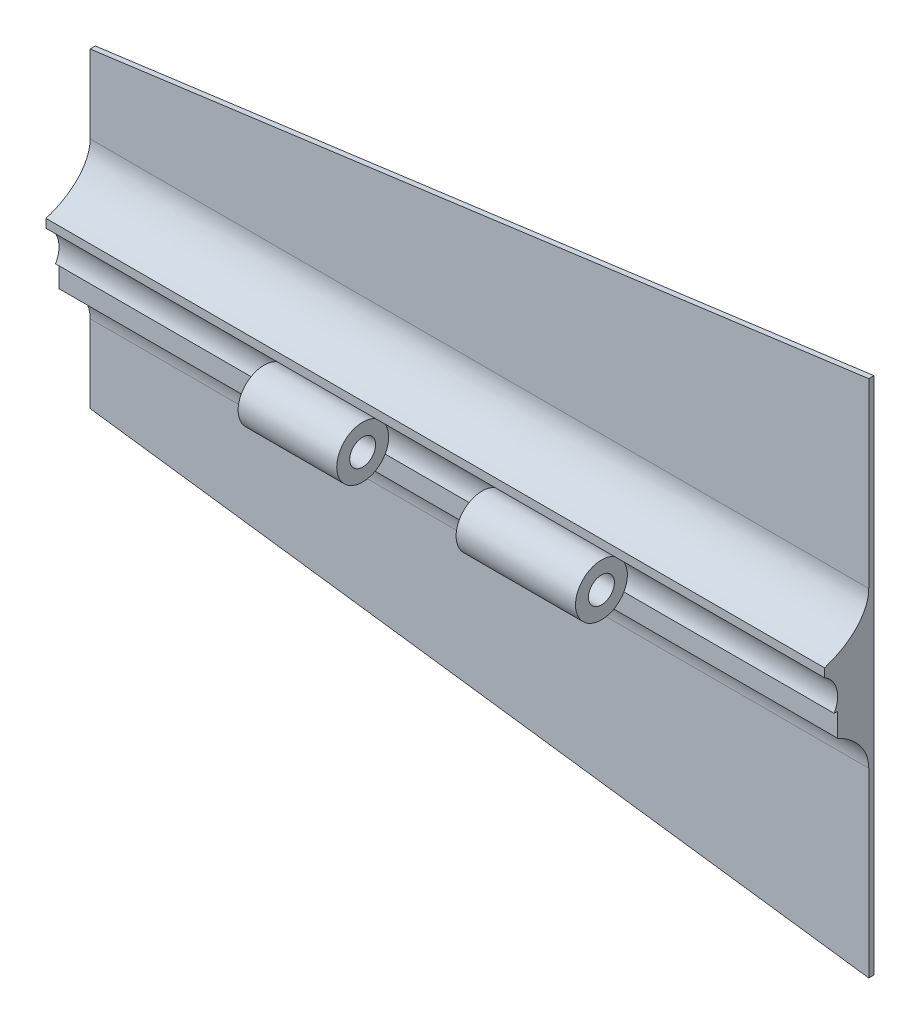
from build123d import *

# Parameters (mm, degrees)
BOSS_EXTRUDE1_DEPTH      = 1
BOSS_EXTRUDE5_DEPTH      = 100
BOSS_EXTRUDE5_DEPTH_BACK = 1
SKETCH2_W                = 214
SKETCH2_H                = 10
FILLET3_SIZE             = 15
FILLET3_SIZE_2           = 10
CUT_EXTRUDE2_DEPTH       = 229
SKETCH7_W                = 64
SKETCH7_H                = 10
CUT_EXTRUDE3_DEPTH       = 14
EXTRUDE_THIN2_START      = -40.5
SKETCH9_R                = 5
SKETCH9_R_2              = 2.5
EXTRUDE_THIN2_DEPTH      = 23
EXTRUDE_THIN3_START      = -86.5
SKETCH9_3_R              = 5
SKETCH9_3_R_2            = 2.5
EXTRUDE_THIN3_DEPTH      = 19
CUT_EXTRUDE8_DEPTH       = 71
CUT_EXTRUDE8_DEPTH_BACK  = 153


with BuildPart() as part:
    # Sketch1 → Boss-Extrude1 (new body)
    with BuildSketch(Plane.XY):
        Polygon((75, 50), (75, -50), (-75, -30), (-75, 30), align=None)
    extrude(amount=BOSS_EXTRUDE1_DEPTH)

    # Sketch2 → Boss-Extrude5 (add, two sides: drawn at the far end of the back side and taken through both)
    with BuildSketch(Plane.XY.offset(1).offset(-BOSS_EXTRUDE5_DEPTH_BACK)):
        with Locations((32, 0)):
            Rectangle(SKETCH2_W, SKETCH2_H)
    extrude(amount=BOSS_EXTRUDE5_DEPTH + BOSS_EXTRUDE5_DEPTH_BACK)

    # Fillet3
    # an asymmetric fillet: 15, 10 mm, written as the material it adds along each edge
    with BuildSketch(Plane(origin=(75, -5, 1), x_dir=(0, 0, 1), z_dir=(-1, 0, 0))) as fillet3_piece_1:
        with BuildLine():
            Bezier((FILLET3_SIZE, 0), (0, 0), (0, -FILLET3_SIZE_2), weights=[1, 0.707106781, 1])
            Line((0, -FILLET3_SIZE_2), (0, 0))
            Line((0, 0), (FILLET3_SIZE, 0))
        make_face()
    extrude(amount=150)
    with BuildSketch(Plane(origin=(-75, 5, 1), x_dir=(0, 1, 0), z_dir=(1, 0, 0))) as fillet3_piece_2:
        with BuildLine():
            Bezier((FILLET3_SIZE_2, 0), (0, 0), (0, FILLET3_SIZE), weights=[1, 0.707106781, 1])
            Line((0, FILLET3_SIZE), (0, 0))
            Line((0, 0), (FILLET3_SIZE_2, 0))
        make_face()
    extrude(amount=150)

    # Sketch6 → Cut-Extrude2 (cut)
    with BuildSketch(Plane.ZY.offset(75)):
        with BuildLine():
            Line((9.5, 6.986773712), (9.5, 4.330127019))
            ThreePointArc((9.5, 4.330127019), (7, 0), (9.5, -4.330127019))
            Line((9.5, -4.330127019), (9.5, -7.297871365))
            Line((9.5, -7.297871365), (14.5, -7.297871365))
            Line((14.5, -7.297871365), (14.5, -4.330127019))
            ThreePointArc((14.5, -4.330127019), (17, 0), (14.5, 4.330127019))
            Line((14.5, 4.330127019), (14.5, 6.986773712))
            Line((14.5, 6.986773712), (9.5, 6.986773712))
        make_face()
    extrude(amount=-CUT_EXTRUDE2_DEPTH, mode=Mode.SUBTRACT)


with BuildPart() as cut_extrude2_piece_1:
    # of the separate pieces the step leaves, piece 1, a body of its own (cut_extrude2_pieces)
    add(part.part.solids().sort_by_distance((-75, 5.050125629, 14.5))[0])


with BuildPart() as cut_extrude2_piece_2:
    # of the separate pieces the step leaves, piece 2, a body of its own (cut_extrude2_pieces)
    add(part.part.solids().sort_by_distance((-75, 15, 1))[0])

    # Sketch7 → Cut-Extrude3 (cut)
    with BuildSketch(Plane(origin=(0, 0, 0), x_dir=(-1, 0, 0), z_dir=(0, 0, -1))):
        with Locations((-107, 0)):
            Rectangle(SKETCH7_W, SKETCH7_H)
    extrude(amount=-CUT_EXTRUDE3_DEPTH, mode=Mode.SUBTRACT)

    # Sketch9 → Extrude-Thin2 (add)
    with BuildSketch(Plane(origin=(75, 0, 0), x_dir=(0, 0, -1), z_dir=(1, 0, 0)).offset(EXTRUDE_THIN2_START)):
        with Locations((-12, 0)):
            Circle(SKETCH9_R)
        with Locations((-12, 0)):
            Circle(SKETCH9_R_2, mode=Mode.SUBTRACT)
    extrude(amount=-EXTRUDE_THIN2_DEPTH)

    # Sketch9<3> → Extrude-Thin3 (add)
    with BuildSketch(Plane(origin=(75, 0, 0), x_dir=(0, 0, -1), z_dir=(1, 0, 0)).offset(EXTRUDE_THIN3_START)):
        with Locations((-12, 0)):
            Circle(SKETCH9_3_R)
        with Locations((-12, 0)):
            Circle(SKETCH9_3_R_2, mode=Mode.SUBTRACT)
    extrude(amount=-EXTRUDE_THIN3_DEPTH)

    # Sketch12 → Cut-Extrude8 (cut, two sides: drawn at the far end of the back side and taken through both)
    with BuildSketch(Plane.ZY.offset(30.5).offset(-CUT_EXTRUDE8_DEPTH_BACK)):
        with BuildLine():
            Line((7, -2.5), (7.669872981, -2.5))
            ThreePointArc((7.669872981, -2.5), (8.464466094, -3.535533906), (9.5, -4.330127019))
            Line((9.5, -4.330127019), (9.5, -7.690384485))
            Line((9.5, -7.690384485), (7, -7.690384485))
            Line((7, -7.690384485), (7, -2.5))
        make_face()
    extrude(amount=CUT_EXTRUDE8_DEPTH + CUT_EXTRUDE8_DEPTH_BACK, mode=Mode.SUBTRACT)


solid = cut_extrude2_piece_2.part
